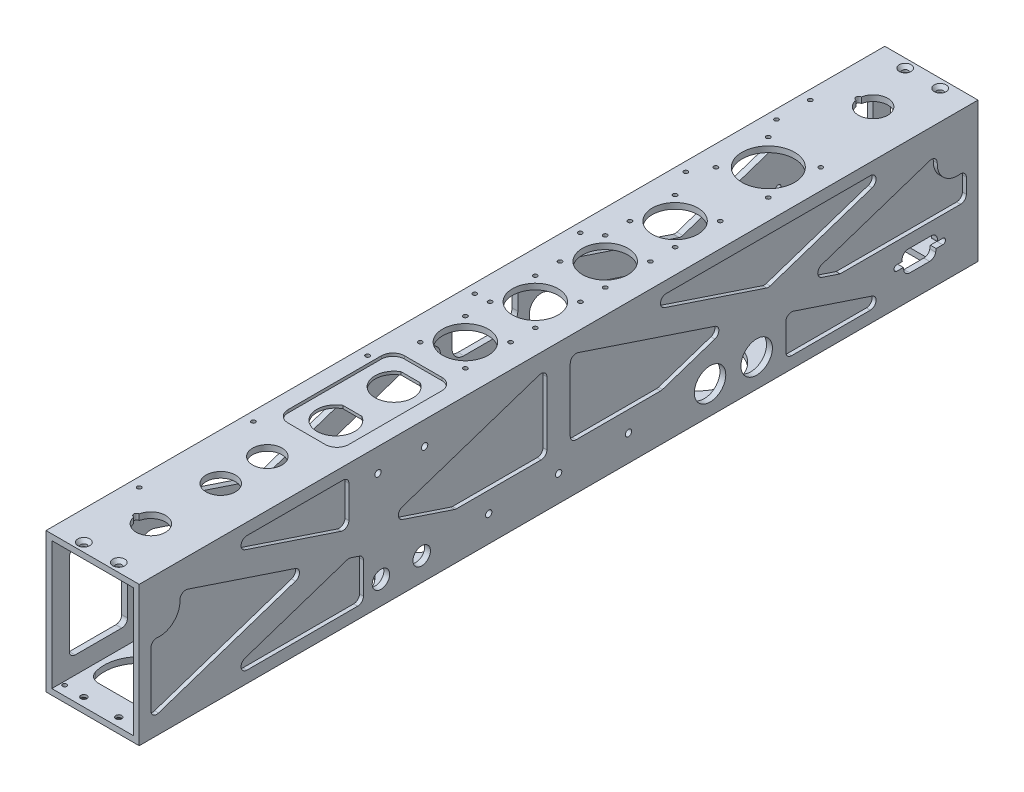
from build123d import *

# Parameters (mm, degrees)
SKETCH1_W                                     = 50.8
SKETCH1_H                                     = 76.2
SKETCH1_W_2                                   = 44.45
SKETCH1_H_2                                   = 69.85
BOSS_EXTRUDE1_DEPTH                           = 457.2
CUT_EXTRUDE2_REACH                            = 468.282
SKETCH6_W                                     = 53.975
SKETCH6_H                                     = 76.2
BOSS_EXTRUDE2_DEPTH                           = 3.175
CUT_EXTRUDE4_REACH                            = 468.282
SKETCH7_W                                     = 31.75
SKETCH7_H                                     = 50.8
FILLET1_R                                     = 3.175
CUT_EXTRUDE6_REACH                            = 468.282
CUT_EXTRUDE5_REACH                            = 468.282
SKETCH8_R                                     = 8.001
SKETCH8_R_2                                   = 14.2875
F_4_40_TAPPED_HOLE1_D                         = 2.2606
F_4_40_TAPPED_HOLE1_DEPTH                     = 3.175
SKETCH12_R                                    = 11.1125
BOSS_EXTRUDE3_DEPTH                           = 3.175
BOSS_EXTRUDE7_DEPTH                           = 3.175
FILLET6_R                                     = 3.175
CUT_EXTRUDE9_REACH                            = 468.282
SKETCH18_R                                    = 1.524
CUT_EXTRUDE10_REACH                           = 468.282
SKETCH19_R                                    = 12.4333
F_4_40_TAPPED_HOLE2_REACH                     = 468.282
F_4_40_TAPPED_HOLE2_BORE_R                    = 1.1303
LPATTERN1_COUNT                               = 4
LPATTERN1_PITCH                               = 38.1
CUT_EXTRUDE11_REACH                           = 468.282
F_6_32_TAPPED_HOLE1_D                         = 2.7051
F_6_32_TAPPED_HOLE1_DEPTH                     = 3.175
LPATTERN2_COUNT                               = 2
LPATTERN2_PITCH                               = 177.8
CUT_EXTRUDE14_REACH                           = 467.947
CUT_EXTRUDE15_REACH                           = 468.282
CUT_EXTRUDE16_REACH                           = 468.282
CUT_EXTRUDE17_REACH                           = 468.282
SKETCH31_R                                    = 19.05
BOSS_EXTRUDE6_DEPTH                           = 3.175
FILLET7_R                                     = 3.175
FILLET8_R                                     = 3.175
F_8_32_TAPPED_HOLE1_D                         = 3.4544
SKETCH40_W                                    = 127
SKETCH40_H                                    = 25.4
BOSS_EXTRUDE8_DEPTH                           = 3.175
FILLET9_R                                     = 3.175
F_8_32_TAPPED_HOLE2_D                         = 3.4544
F_8_32_TAPPED_HOLE2_DEPTH                     = 3.175
BOSS_EXTRUDE9_DEPTH                           = 3.175
FILLET11_R                                    = 3.175
FILLET12_R                                    = 3.175
CUT_EXTRUDE18_REACH                           = 468.282
SKETCH45_R                                    = 4.7625
BOSS_EXTRUDE10_DEPTH                          = 3.175
FILLET13_R                                    = 3.175
CUT_EXTRUDE19_REACH                           = 468.282
SKETCH47_R                                    = 8.5725
CSK_FOR_4_FLAT_HEAD_SOCKET_CAP_SCREW1_A_COUNT = 2
CSK_FOR_4_FLAT_HEAD_SOCKET_CAP_SCREW1_A_PITCH = 19.05
BOSS_EXTRUDE11_START                          = -1.016
BOSS_EXTRUDE11_DEPTH                          = 1.016
BOSS_EXTRUDE12_DEPTH                          = 3.175
FILLET14_R                                    = 6.35
F_4_40_TAPPED_HOLE3_D                         = 2.2606
F_4_40_TAPPED_HOLE3_DEPTH                     = 3.175
CUT_EXTRUDE20_DEPTH                           = 1.5875
F_4_40_TAPPED_HOLE4_D                         = 2.2606
F_4_40_TAPPED_HOLE4_DEPTH                     = 7.62
F_4_40_TAPPED_HOLE4_TIP                       = 0.679152758


with BuildPart() as part:
    # Sketch1 → Boss-Extrude1 (new body)
    with BuildSketch(Plane.XY):
        with Locations((25.4, 38.1)):
            Rectangle(SKETCH1_W, SKETCH1_H)
        with Locations((25.4, 38.1)):
            Rectangle(SKETCH1_W_2, SKETCH1_H_2, mode=Mode.SUBTRACT)
    extrude(amount=BOSS_EXTRUDE1_DEPTH)

    # Sketch2 → Cut-Extrude2 (cut, up to next)
    with BuildSketch(Plane(origin=(50.8, 0, 0), x_dir=(0, 0, -1), z_dir=(1, 0, 0)), mode=Mode.PRIVATE) as cut_extrude2_sk1:
        with BuildLine():
            Line((-222.25, 62.984768429), (-222.25, 13.215231571))
            ThreePointArc((-222.25, 13.215231571), (-220.931455154, 10.639537633), (-218.070976843, 10.2031621))
            Line((-218.070976843, 10.2031621), (-143.416671556, 35.087930529))
            ThreePointArc((-143.416671556, 35.087930529), (-141.245694713, 38.1), (-143.416671556, 41.112069471))
            Line((-143.416671556, 41.112069471), (-218.070976843, 65.9968379))
            ThreePointArc((-218.070976843, 65.9968379), (-220.931455154, 65.560462367), (-222.25, 62.984768429))
        make_face()
    cut_extrude2_tool1 = extrude(cut_extrude2_sk1.sketch, amount=-CUT_EXTRUDE2_REACH, mode=Mode.PRIVATE) & part.part
    # Sketch2 → Cut-Extrude2 (cut, up to next)
    with BuildSketch(Plane(origin=(50.8, 0, 0), x_dir=(0, 0, -1), z_dir=(1, 0, 0)), mode=Mode.PRIVATE) as cut_extrude2_sk2:
        with BuildLine():
            Line((-399.508328444, 63.662930529), (-343.904023157, 45.1281621))
            ThreePointArc((-343.904023157, 45.1281621), (-342.9, 44.965231571), (-341.895976843, 45.1281621))
            Line((-341.895976843, 45.1281621), (-286.291671556, 63.662930529))
            ThreePointArc((-286.291671556, 63.662930529), (-284.161692035, 67.183578622), (-287.295694713, 69.85))
            Line((-287.295694713, 69.85), (-398.504305287, 69.85))
            ThreePointArc((-398.504305287, 69.85), (-401.638307965, 67.183578622), (-399.508328444, 63.662930529))
        make_face()
    cut_extrude2_tool2 = extrude(cut_extrude2_sk2.sketch, amount=-CUT_EXTRUDE2_REACH, mode=Mode.PRIVATE) & part.part
    # Sketch2 → Cut-Extrude2 (cut, up to next)
    with BuildSketch(Plane(origin=(50.8, 0, 0), x_dir=(0, 0, -1), z_dir=(1, 0, 0)), mode=Mode.PRIVATE) as cut_extrude2_sk3:
        with BuildLine():
            Line((-446.670976843, 65.9968379), (-372.016671556, 41.112069471))
            ThreePointArc((-372.016671556, 41.112069471), (-369.845694713, 38.1), (-372.016671556, 35.087930529))
            Line((-372.016671556, 35.087930529), (-446.670976843, 10.2031621))
            ThreePointArc((-446.670976843, 10.2031621), (-449.531455154, 10.639537633), (-450.85, 13.215231571))
            Line((-450.85, 13.215231571), (-450.85, 62.984768429))
            ThreePointArc((-450.85, 62.984768429), (-449.531455154, 65.560462367), (-446.670976843, 65.9968379))
        make_face()
    cut_extrude2_tool3 = extrude(cut_extrude2_sk3.sketch, amount=-CUT_EXTRUDE2_REACH, mode=Mode.PRIVATE) & part.part
    # Sketch2 → Cut-Extrude2 (cut, up to next)
    with BuildSketch(Plane(origin=(50.8, 0, 0), x_dir=(0, 0, -1), z_dir=(1, 0, 0)), mode=Mode.PRIVATE) as cut_extrude2_sk4:
        with BuildLine():
            Line((-234.95, 62.984768429), (-234.95, 13.215231571))
            ThreePointArc((-234.95, 13.215231571), (-236.268544846, 10.639537633), (-239.129023157, 10.2031621))
            Line((-239.129023157, 10.2031621), (-313.783328444, 35.087930529))
            ThreePointArc((-313.783328444, 35.087930529), (-315.954305287, 38.1), (-313.783328444, 41.112069471))
            Line((-313.783328444, 41.112069471), (-239.129023157, 65.9968379))
            ThreePointArc((-239.129023157, 65.9968379), (-236.268544846, 65.560462367), (-234.95, 62.984768429))
        make_face()
    cut_extrude2_tool4 = extrude(cut_extrude2_sk4.sketch, amount=-CUT_EXTRUDE2_REACH, mode=Mode.PRIVATE) & part.part
    # Sketch2 → Cut-Extrude2 (cut, up to next)
    with BuildSketch(Plane(origin=(50.8, 0, 0), x_dir=(0, 0, -1), z_dir=(1, 0, 0)), mode=Mode.PRIVATE) as cut_extrude2_sk5:
        with BuildLine():
            Line((-57.691671556, 63.662930529), (-113.295976843, 45.1281621))
            ThreePointArc((-113.295976843, 45.1281621), (-114.3, 44.965231571), (-115.304023157, 45.1281621))
            Line((-115.304023157, 45.1281621), (-170.908328444, 63.662930529))
            ThreePointArc((-170.908328444, 63.662930529), (-173.038307965, 67.183578622), (-169.904305287, 69.85))
            Line((-169.904305287, 69.85), (-58.695694713, 69.85))
            ThreePointArc((-58.695694713, 69.85), (-55.561692035, 67.183578622), (-57.691671556, 63.662930529))
        make_face()
    cut_extrude2_tool5 = extrude(cut_extrude2_sk5.sketch, amount=-CUT_EXTRUDE2_REACH, mode=Mode.PRIVATE) & part.part
    # Sketch2 → Cut-Extrude2 (cut, up to next)
    with BuildSketch(Plane(origin=(50.8, 0, 0), x_dir=(0, 0, -1), z_dir=(1, 0, 0)), mode=Mode.PRIVATE) as cut_extrude2_sk6:
        with BuildLine():
            Line((-10.529023157, 65.9968379), (-85.183328444, 41.112069471))
            ThreePointArc((-85.183328444, 41.112069471), (-87.354305287, 38.1), (-85.183328444, 35.087930529))
            Line((-85.183328444, 35.087930529), (-10.529023157, 10.2031621))
            ThreePointArc((-10.529023157, 10.2031621), (-7.668544846, 10.639537633), (-6.35, 13.215231571))
            Line((-6.35, 13.215231571), (-6.35, 62.984768429))
            ThreePointArc((-6.35, 62.984768429), (-7.668544846, 65.560462367), (-10.529023157, 65.9968379))
        make_face()
    cut_extrude2_tool6 = extrude(cut_extrude2_sk6.sketch, amount=-CUT_EXTRUDE2_REACH, mode=Mode.PRIVATE) & part.part
    # Sketch2 → Cut-Extrude2 (cut, up to next)
    with BuildSketch(Plane(origin=(50.8, 0, 0), x_dir=(0, 0, -1), z_dir=(1, 0, 0)), mode=Mode.PRIVATE) as cut_extrude2_sk7:
        with BuildLine():
            Line((-398.504305287, 6.35), (-287.295694713, 6.35))
            ThreePointArc((-287.295694713, 6.35), (-284.161692035, 9.016421378), (-286.291671556, 12.537069471))
            Line((-286.291671556, 12.537069471), (-341.895976843, 31.0718379))
            ThreePointArc((-341.895976843, 31.0718379), (-342.9, 31.234768429), (-343.904023157, 31.0718379))
            Line((-343.904023157, 31.0718379), (-399.508328444, 12.537069471))
            ThreePointArc((-399.508328444, 12.537069471), (-401.638307965, 9.016421378), (-398.504305287, 6.35))
        make_face()
    cut_extrude2_tool7 = extrude(cut_extrude2_sk7.sketch, amount=-CUT_EXTRUDE2_REACH, mode=Mode.PRIVATE) & part.part
    # Sketch2 → Cut-Extrude2 (cut, up to next)
    with BuildSketch(Plane(origin=(50.8, 0, 0), x_dir=(0, 0, -1), z_dir=(1, 0, 0)), mode=Mode.PRIVATE) as cut_extrude2_sk8:
        with BuildLine():
            Line((-113.295976843, 31.0718379), (-57.691671556, 12.537069471))
            ThreePointArc((-57.691671556, 12.537069471), (-55.561692035, 9.016421378), (-58.695694713, 6.35))
            Line((-58.695694713, 6.35), (-169.904305287, 6.35))
            ThreePointArc((-169.904305287, 6.35), (-173.038307965, 9.016421378), (-170.908328444, 12.537069471))
            Line((-170.908328444, 12.537069471), (-115.304023157, 31.0718379))
            ThreePointArc((-115.304023157, 31.0718379), (-114.3, 31.234768429), (-113.295976843, 31.0718379))
        make_face()
    cut_extrude2_tool8 = extrude(cut_extrude2_sk8.sketch, amount=-CUT_EXTRUDE2_REACH, mode=Mode.PRIVATE) & part.part
    add(cut_extrude2_tool1.solids().sort_by_distance((50.8, 38.1, 193.233439))[0], mode=Mode.SUBTRACT)
    add(cut_extrude2_tool2.solids().sort_by_distance((50.8, 61.149745, 342.9))[0], mode=Mode.SUBTRACT)
    add(cut_extrude2_tool3.solids().sort_by_distance((50.8, 38.1, 421.833439))[0], mode=Mode.SUBTRACT)
    add(cut_extrude2_tool4.solids().sort_by_distance((50.8, 38.1, 263.966561))[0], mode=Mode.SUBTRACT)
    add(cut_extrude2_tool5.solids().sort_by_distance((50.8, 61.149745, 114.3))[0], mode=Mode.SUBTRACT)
    add(cut_extrude2_tool6.solids().sort_by_distance((50.8, 38.1, 35.366561))[0], mode=Mode.SUBTRACT)
    add(cut_extrude2_tool7.solids().sort_by_distance((50.8, 15.050255, 342.9))[0], mode=Mode.SUBTRACT)
    add(cut_extrude2_tool8.solids().sort_by_distance((50.8, 15.050255, 114.3))[0], mode=Mode.SUBTRACT)

    # Sketch6 → Boss-Extrude2 (add)
    with BuildSketch(Plane.ZY):
        with Locations((26.9875, 38.1)):
            Rectangle(SKETCH6_W, SKETCH6_H)
    boss_extrude2 = extrude(amount=-BOSS_EXTRUDE2_DEPTH)

    # Sketch7 → Cut-Extrude4 (cut, up to next)
    with BuildSketch(Plane.ZY, mode=Mode.PRIVATE) as cut_extrude4_sk1:
        with Locations((25.4, 38.1)):
            Rectangle(SKETCH7_W, SKETCH7_H)
    cut_extrude4_tool1 = extrude(cut_extrude4_sk1.sketch, amount=-CUT_EXTRUDE4_REACH, mode=Mode.PRIVATE) & part.part
    cut_extrude4 = cut_extrude4_tool1.solids().sort_by_distance((0, 38.1, 25.4))[0]
    add(cut_extrude4, mode=Mode.SUBTRACT)

    # Mirror1: Boss-Extrude2, Cut-Extrude4 across plane
    add(boss_extrude2.mirror(Plane.XY.offset(228.6)))
    add(cut_extrude4.mirror(Plane.XY.offset(228.6)), mode=Mode.SUBTRACT)

    # Fillet1
    fillet1_edges = [part.edges().sort_by_distance(p)[0] for p in [
        (1.5875, 63.5, 41.275),
        (1.5875, 12.7, 41.275),
        (1.5875, 12.7, 9.525),
        (1.5875, 63.5, 9.525),
        (1.5875, 12.7, 415.925),
        (1.5875, 63.5, 415.925),
        (1.5875, 63.5, 447.675),
        (1.5875, 12.7, 447.675),
    ]]
    fillet(fillet1_edges, radius=FILLET1_R)

    # Sketch11 → Cut-Extrude6 (cut, up to next)
    with BuildSketch(Plane(origin=(0, 76.2, 0), x_dir=(1, 0, 0), z_dir=(0, 1, 0)), mode=Mode.PRIVATE) as cut_extrude6_sk1:
        with BuildLine():
            ThreePointArc((17.541666667, -33.248865312), (33.4, -31.75), (17.541666667, -30.251134688))
            ThreePointArc((17.541666667, -30.251134688), (16.1, -31.75), (17.541666667, -33.248865312))
        make_face()
    cut_extrude6_tool1 = extrude(cut_extrude6_sk1.sketch, amount=-CUT_EXTRUDE6_REACH, mode=Mode.PRIVATE) & part.part
    cut_extrude6 = cut_extrude6_tool1.solids().sort_by_distance((25.271641, 76.2, 31.75))[0]
    add(cut_extrude6, mode=Mode.SUBTRACT)

    # Mirror3: Cut-Extrude6 across plane
    add(cut_extrude6.mirror(Plane.XY.offset(228.6)), mode=Mode.SUBTRACT)

    # Sketch8 → Cut-Extrude5 (cut, up to next)
    with BuildSketch(Plane(origin=(0, 76.2, 0), x_dir=(1, 0, 0), z_dir=(0, 1, 0)), mode=Mode.PRIVATE) as cut_extrude5_sk1:
        with Locations(Location((25.4, -387.35, 0), (0, 0, 270))):
            Circle(SKETCH8_R)
    cut_extrude5_tool1 = extrude(cut_extrude5_sk1.sketch, amount=-CUT_EXTRUDE5_REACH, mode=Mode.PRIVATE) & part.part
    # Sketch8 → Cut-Extrude5 (cut, up to next)
    with BuildSketch(Plane(origin=(0, 76.2, 0), x_dir=(1, 0, 0), z_dir=(0, 1, 0)), mode=Mode.PRIVATE) as cut_extrude5_sk2:
        with Locations(Location((25.4, -88.9, 0), (0, 0, 270))):
            Circle(SKETCH8_R_2)
    cut_extrude5_tool2 = extrude(cut_extrude5_sk2.sketch, amount=-CUT_EXTRUDE5_REACH, mode=Mode.PRIVATE) & part.part
    # Sketch8 → Cut-Extrude5 (cut, up to next)
    with BuildSketch(Plane(origin=(0, 76.2, 0), x_dir=(1, 0, 0), z_dir=(0, 1, 0)), mode=Mode.PRIVATE) as cut_extrude5_sk3:
        with Locations(Location((25.4, -361.95, 0), (0, 0, 270))):
            Circle(SKETCH8_R)
    cut_extrude5_tool3 = extrude(cut_extrude5_sk3.sketch, amount=-CUT_EXTRUDE5_REACH, mode=Mode.PRIVATE) & part.part
    add(cut_extrude5_tool1.solids().sort_by_distance((25.4, 76.2, 387.35))[0], mode=Mode.SUBTRACT)
    add(cut_extrude5_tool2.solids().sort_by_distance((25.4, 76.2, 88.9))[0], mode=Mode.SUBTRACT)
    add(cut_extrude5_tool3.solids().sort_by_distance((25.4, 76.2, 361.95))[0], mode=Mode.SUBTRACT)

    # #4-40 Tapped Hole1
    with Locations(Plane(origin=(0, 76.2, 0), x_dir=(-1, 0, 0), z_dir=(0, 1, 0))):
        with Locations((-11.1125, 74.6125), (-39.6875, 74.6125), (-39.6875, 103.1875), (-11.1125, 103.1875)):
            Hole(F_4_40_TAPPED_HOLE1_D / 2, depth=F_4_40_TAPPED_HOLE1_DEPTH)

    # Sketch12 → Boss-Extrude3 (add)
    with BuildSketch(Plane(origin=(50.8, 0, 0), x_dir=(0, 0, -1), z_dir=(1, 0, 0))):
        with Locations((-11.1125, 57.15)):
            Circle(SKETCH12_R)
        with Locations((-446.0875, 57.15)):
            Circle(SKETCH12_R)
    extrude(amount=-BOSS_EXTRUDE3_DEPTH)

    # Sketch36 → Boss-Extrude7 (add)
    with BuildSketch(Plane(origin=(50.8, 0, 0), x_dir=(0, 0, -1), z_dir=(1, 0, 0))):
        with BuildLine():
            Line((-75.169536858, 31.75), (-6.35, 31.75))
            Line((-6.35, 31.75), (-6.35, 13.215231571))
            ThreePointArc((-6.35, 13.215231571), (-7.668544846, 10.639537633), (-10.529023157, 10.2031621))
            Line((-10.529023157, 10.2031621), (-75.169536858, 31.75))
        make_face()
    extrude(amount=-BOSS_EXTRUDE7_DEPTH)

    # Fillet6
    fillet6_edges = [part.edges().sort_by_distance(p)[0] for p in [
        (49.2125, 31.75, 6.35),
    ]]
    fillet(fillet6_edges, radius=FILLET6_R)

    # Sketch18 → Cut-Extrude9 (cut, up to next)
    with BuildSketch(Plane(origin=(50.8, 0, 0), x_dir=(0, 0, -1), z_dir=(1, 0, 0)), mode=Mode.PRIVATE) as cut_extrude9_sk1:
        with BuildLine():
            Line((-38.051029637, 24.892), (-25.448970363, 24.892))
            ThreePointArc((-25.448970363, 24.892), (-22.919491612, 23.712484687), (-22.197135162, 21.016613717))
            Line((-22.197135162, 21.016613717), (-23.092876224, 15.936613717))
            ThreePointArc((-23.092876224, 15.936613717), (-24.222226738, 13.980521249), (-26.344711425, 13.208))
            Line((-26.344711425, 13.208), (-37.155288575, 13.208))
            ThreePointArc((-37.155288575, 13.208), (-39.277773262, 13.980521249), (-40.407123776, 15.936613717))
            Line((-40.407123776, 15.936613717), (-41.302864838, 21.016613717))
            ThreePointArc((-41.302864838, 21.016613717), (-40.580508388, 23.712484687), (-38.051029637, 24.892))
        make_face()
    cut_extrude9_tool1 = extrude(cut_extrude9_sk1.sketch, amount=-CUT_EXTRUDE9_REACH, mode=Mode.PRIVATE) & part.part
    # Sketch18 → Cut-Extrude9 (cut, up to next)
    with BuildSketch(Plane(origin=(50.8, 0, 0), x_dir=(0, 0, -1), z_dir=(1, 0, 0)), mode=Mode.PRIVATE) as cut_extrude9_sk2:
        with BuildLine():
            Line((-40.68737546, 17.526), (-41.224820097, 20.574))
            Line((-41.224820097, 20.574), (-44.2468, 20.574))
            ThreePointArc((-44.2468, 20.574), (-43.169169265, 20.127630735), (-42.7228, 19.05))
            ThreePointArc((-42.7228, 19.05), (-43.169169265, 17.972369265), (-44.2468, 17.526))
            Line((-44.2468, 17.526), (-40.68737546, 17.526))
        make_face()
    cut_extrude9_tool2 = extrude(cut_extrude9_sk2.sketch, amount=-CUT_EXTRUDE9_REACH, mode=Mode.PRIVATE) & part.part
    # Sketch18 → Cut-Extrude9 (cut, up to next)
    with BuildSketch(Plane(origin=(50.8, 0, 0), x_dir=(0, 0, -1), z_dir=(1, 0, 0)), mode=Mode.PRIVATE) as cut_extrude9_sk3:
        with Locations((-44.2468, 19.05)):
            Circle(SKETCH18_R)
    cut_extrude9_tool3 = extrude(cut_extrude9_sk3.sketch, amount=-CUT_EXTRUDE9_REACH, mode=Mode.PRIVATE) & part.part
    # Sketch18 → Cut-Extrude9 (cut, up to next)
    with BuildSketch(Plane(origin=(50.8, 0, 0), x_dir=(0, 0, -1), z_dir=(1, 0, 0)), mode=Mode.PRIVATE) as cut_extrude9_sk4:
        with Locations((-19.2532, 19.05)):
            Circle(SKETCH18_R)
    cut_extrude9_tool4 = extrude(cut_extrude9_sk4.sketch, amount=-CUT_EXTRUDE9_REACH, mode=Mode.PRIVATE) & part.part
    # Sketch18 → Cut-Extrude9 (cut, up to next)
    with BuildSketch(Plane(origin=(50.8, 0, 0), x_dir=(0, 0, -1), z_dir=(1, 0, 0)), mode=Mode.PRIVATE) as cut_extrude9_sk5:
        with BuildLine():
            Line((-19.2532, 20.574), (-22.275179903, 20.574))
            Line((-22.275179903, 20.574), (-22.81262454, 17.526))
            Line((-22.81262454, 17.526), (-19.2532, 17.526))
            ThreePointArc((-19.2532, 17.526), (-20.7772, 19.05), (-19.2532, 20.574))
        make_face()
    cut_extrude9_tool5 = extrude(cut_extrude9_sk5.sketch, amount=-CUT_EXTRUDE9_REACH, mode=Mode.PRIVATE) & part.part
    add(cut_extrude9_tool1.solids().sort_by_distance((50.8, 19.189179, 31.75))[0], mode=Mode.SUBTRACT)
    add(cut_extrude9_tool2.solids().sort_by_distance((50.8, 18.984801, 42.024858))[0], mode=Mode.SUBTRACT)
    add(cut_extrude9_tool3.solids().sort_by_distance((50.8, 19.05, 44.2468))[0], mode=Mode.SUBTRACT)
    add(cut_extrude9_tool4.solids().sort_by_distance((50.8, 19.05, 19.2532))[0], mode=Mode.SUBTRACT)
    add(cut_extrude9_tool5.solids().sort_by_distance((50.8, 18.984801, 21.475142))[0], mode=Mode.SUBTRACT)

    # Sketch19 → Cut-Extrude10 (cut, up to next)
    with BuildSketch(Plane(origin=(0, 76.2, 0), x_dir=(1, 0, 0), z_dir=(0, 1, 0)), mode=Mode.PRIVATE) as cut_extrude10_sk1:
        with Locations(Location((25.4, -139.7, 0), (0, 0, 270))):
            Circle(SKETCH19_R)
    cut_extrude10_tool1 = extrude(cut_extrude10_sk1.sketch, amount=-CUT_EXTRUDE10_REACH, mode=Mode.PRIVATE) & part.part
    cut_extrude10 = cut_extrude10_tool1.solids().sort_by_distance((25.4, 76.2, 139.7))[0]
    add(cut_extrude10, mode=Mode.SUBTRACT)

    # #4-40 Tapped Hole2 bore → #4-40 Tapped Hole2 (cut, up to next)
    with BuildSketch(Plane(origin=(0, 76.2, 0), x_dir=(-1, 0, 0), z_dir=(0, 1, 0)), mode=Mode.PRIVATE) as f_4_40_tapped_hole2_sk1:
        with Locations((-13.0937, 127.3937)):
            Circle(F_4_40_TAPPED_HOLE2_BORE_R)
    f_4_40_tapped_hole2_tool1 = extrude(f_4_40_tapped_hole2_sk1.sketch, amount=-F_4_40_TAPPED_HOLE2_REACH, mode=Mode.PRIVATE) & part.part
    # #4-40 Tapped Hole2 bore → #4-40 Tapped Hole2 (cut, up to next)
    with BuildSketch(Plane(origin=(0, 76.2, 0), x_dir=(-1, 0, 0), z_dir=(0, 1, 0)), mode=Mode.PRIVATE) as f_4_40_tapped_hole2_sk2:
        with Locations((-37.7063, 127.3937)):
            Circle(F_4_40_TAPPED_HOLE2_BORE_R)
    f_4_40_tapped_hole2_tool2 = extrude(f_4_40_tapped_hole2_sk2.sketch, amount=-F_4_40_TAPPED_HOLE2_REACH, mode=Mode.PRIVATE) & part.part
    # #4-40 Tapped Hole2 bore → #4-40 Tapped Hole2 (cut, up to next)
    with BuildSketch(Plane(origin=(0, 76.2, 0), x_dir=(-1, 0, 0), z_dir=(0, 1, 0)), mode=Mode.PRIVATE) as f_4_40_tapped_hole2_sk3:
        with Locations((-37.7063, 152.0063)):
            Circle(F_4_40_TAPPED_HOLE2_BORE_R)
    f_4_40_tapped_hole2_tool3 = extrude(f_4_40_tapped_hole2_sk3.sketch, amount=-F_4_40_TAPPED_HOLE2_REACH, mode=Mode.PRIVATE) & part.part
    # #4-40 Tapped Hole2 bore → #4-40 Tapped Hole2 (cut, up to next)
    with BuildSketch(Plane(origin=(0, 76.2, 0), x_dir=(-1, 0, 0), z_dir=(0, 1, 0)), mode=Mode.PRIVATE) as f_4_40_tapped_hole2_sk4:
        with Locations((-13.0937, 152.0063)):
            Circle(F_4_40_TAPPED_HOLE2_BORE_R)
    f_4_40_tapped_hole2_tool4 = extrude(f_4_40_tapped_hole2_sk4.sketch, amount=-F_4_40_TAPPED_HOLE2_REACH, mode=Mode.PRIVATE) & part.part
    f_4_40_tapped_hole2_1 = f_4_40_tapped_hole2_tool1.solids().sort_by_distance((13.0937, 76.2, 127.3937))[0]
    add(f_4_40_tapped_hole2_1, mode=Mode.SUBTRACT)
    f_4_40_tapped_hole2_2 = f_4_40_tapped_hole2_tool2.solids().sort_by_distance((37.7063, 76.2, 127.3937))[0]
    add(f_4_40_tapped_hole2_2, mode=Mode.SUBTRACT)
    f_4_40_tapped_hole2_3 = f_4_40_tapped_hole2_tool3.solids().sort_by_distance((37.7063, 76.2, 152.0063))[0]
    add(f_4_40_tapped_hole2_3, mode=Mode.SUBTRACT)
    f_4_40_tapped_hole2_4 = f_4_40_tapped_hole2_tool4.solids().sort_by_distance((13.0937, 76.2, 152.0063))[0]
    add(f_4_40_tapped_hole2_4, mode=Mode.SUBTRACT)
    f_4_40_tapped_hole2 = f_4_40_tapped_hole2_1 + f_4_40_tapped_hole2_2 + f_4_40_tapped_hole2_3 + f_4_40_tapped_hole2_4  # #4-40 Tapped Hole2 as one shape, for the pattern or mirror that repeats it

    # LPattern1: Cut-Extrude10, #4-40 Tapped Hole2 ×4
    with Locations(*[(0, 0, i * LPATTERN1_PITCH) for i in range(1, LPATTERN1_COUNT)]):
        add(cut_extrude10, mode=Mode.SUBTRACT)
        add(f_4_40_tapped_hole2, mode=Mode.SUBTRACT)

    # Sketch22 → Cut-Extrude11 (cut, up to next)
    with BuildSketch(Plane(origin=(0, 76.2, 0), x_dir=(1, 0, 0), z_dir=(0, 1, 0)), mode=Mode.PRIVATE) as cut_extrude11_sk1:
        with BuildLine():
            Line((20.193309765, -283.8577), (30.606690235, -283.8577))
            ThreePointArc((30.606690235, -283.8577), (25.4, -303.2633), (20.193309765, -283.8577))
        make_face()
    cut_extrude11_tool1 = extrude(cut_extrude11_sk1.sketch, amount=-CUT_EXTRUDE11_REACH, mode=Mode.PRIVATE) & part.part
    # Sketch22 → Cut-Extrude11 (cut, up to next)
    with BuildSketch(Plane(origin=(0, 76.2, 0), x_dir=(1, 0, 0), z_dir=(0, 1, 0)), mode=Mode.PRIVATE) as cut_extrude11_sk2:
        with BuildLine():
            Line((20.193309765, -315.6077), (30.606690235, -315.6077))
            ThreePointArc((30.606690235, -315.6077), (25.4, -335.0133), (20.193309765, -315.6077))
        make_face()
    cut_extrude11_tool2 = extrude(cut_extrude11_sk2.sketch, amount=-CUT_EXTRUDE11_REACH, mode=Mode.PRIVATE) & part.part
    add(cut_extrude11_tool1.solids().sort_by_distance((25.4, 76.2, 293.147117))[0], mode=Mode.SUBTRACT)
    add(cut_extrude11_tool2.solids().sort_by_distance((25.4, 76.2, 324.897117))[0], mode=Mode.SUBTRACT)

    # #6-32 Tapped Hole1
    with Locations(Plane.ZY):
        with Locations((61.214, 41.656), (61.214, 13.462), (203.2, 13.462), (203.2, 41.656)):
            f_6_32_tapped_hole1 = Hole(F_6_32_TAPPED_HOLE1_D / 2, depth=F_6_32_TAPPED_HOLE1_DEPTH)

    # LPattern2: #6-32 Tapped Hole1 ×2
    with Locations(*[(0, 0, i * LPATTERN2_PITCH) for i in range(1, LPATTERN2_COUNT)]):
        add(f_6_32_tapped_hole1, mode=Mode.SUBTRACT)

    # Sketch27 → Cut-Extrude14 (cut, up to next)
    with BuildSketch(Plane(origin=(3.175, 0, 0), x_dir=(0, 0, -1), z_dir=(1, 0, 0)), mode=Mode.PRIVATE) as cut_extrude14_sk1:
        with BuildLine():
            Line((-170.908328444, 63.662930529), (-115.304023157, 45.1281621))
            ThreePointArc((-115.304023157, 45.1281621), (-114.3, 44.965231571), (-113.295976843, 45.1281621))
            Line((-113.295976843, 45.1281621), (-57.691671556, 63.662930529))
            ThreePointArc((-57.691671556, 63.662930529), (-55.561692035, 67.183578622), (-58.695694713, 69.85))
            Line((-58.695694713, 69.85), (-169.904305287, 69.85))
            ThreePointArc((-169.904305287, 69.85), (-173.038307965, 67.183578622), (-170.908328444, 63.662930529))
        make_face()
    cut_extrude14_tool1 = extrude(cut_extrude14_sk1.sketch, amount=-CUT_EXTRUDE14_REACH, mode=Mode.PRIVATE) & part.part
    # Sketch27 → Cut-Extrude14 (cut, up to next)
    with BuildSketch(Plane(origin=(3.175, 0, 0), x_dir=(0, 0, -1), z_dir=(1, 0, 0)), mode=Mode.PRIVATE) as cut_extrude14_sk2:
        with BuildLine():
            Line((-203.2, 19.812), (-190.274926284, 19.812))
            ThreePointArc((-190.274926284, 19.812), (-189.257769041, 19.893994644), (-188.26687997, 20.137861057))
            Line((-188.26687997, 20.137861057), (-143.416671556, 35.087930529))
            ThreePointArc((-143.416671556, 35.087930529), (-141.245694713, 38.1), (-143.416671556, 41.112069471))
            Line((-143.416671556, 41.112069471), (-188.491953686, 56.137163515))
            ThreePointArc((-188.491953686, 56.137163515), (-194.212910308, 55.264412448), (-196.85, 50.113024572))
            Line((-196.85, 50.113024572), (-196.85, 41.656))
            ThreePointArc((-196.85, 41.656), (-198.709871939, 37.165871939), (-203.2, 35.306))
            Line((-203.2, 35.306), (-215.9, 35.306))
            ThreePointArc((-215.9, 35.306), (-220.390128061, 33.446128061), (-222.25, 28.956))
            Line((-222.25, 28.956), (-222.25, 13.215231571))
            ThreePointArc((-222.25, 13.215231571), (-220.931455154, 10.639537633), (-218.070976843, 10.2031621))
            Line((-218.070976843, 10.2031621), (-213.096729084, 11.861244686))
            ThreePointArc((-213.096729084, 11.861244686), (-210.691634147, 13.319566692), (-209.152387699, 15.673691814))
            ThreePointArc((-209.152387699, 15.673691814), (-206.824793579, 18.675767497), (-203.2, 19.812))
        make_face()
    cut_extrude14_tool2 = extrude(cut_extrude14_sk2.sketch, amount=-CUT_EXTRUDE14_REACH, mode=Mode.PRIVATE) & part.part
    # Sketch27 → Cut-Extrude14 (cut, up to next)
    with BuildSketch(Plane(origin=(3.175, 0, 0), x_dir=(0, 0, -1), z_dir=(1, 0, 0)), mode=Mode.PRIVATE) as cut_extrude14_sk3:
        with BuildLine():
            Line((-66.675, 13.243101762), (-66.675, 9.525))
            ThreePointArc((-66.675, 9.525), (-67.60493597, 7.27993597), (-69.85, 6.35))
            Line((-69.85, 6.35), (-169.904305287, 6.35))
            ThreePointArc((-169.904305287, 6.35), (-173.038307965, 9.016421378), (-170.908328444, 12.537069471))
            Line((-170.908328444, 12.537069471), (-115.304023157, 31.0718379))
            ThreePointArc((-115.304023157, 31.0718379), (-114.3, 31.234768429), (-113.295976843, 31.0718379))
            Line((-113.295976843, 31.0718379), (-68.845976843, 16.255171234))
            ThreePointArc((-68.845976843, 16.255171234), (-67.274306062, 15.099556916), (-66.675, 13.243101762))
        make_face()
    cut_extrude14_tool3 = extrude(cut_extrude14_sk3.sketch, amount=-CUT_EXTRUDE14_REACH, mode=Mode.PRIVATE) & part.part
    add(cut_extrude14_tool1.solids().sort_by_distance((3.175, 61.149745, 114.3))[0], mode=Mode.SUBTRACT)
    add(cut_extrude14_tool2.solids().sort_by_distance((3.175, 34.226648, 186.059906))[0], mode=Mode.SUBTRACT)
    add(cut_extrude14_tool3.solids().sort_by_distance((3.175, 15.285641, 116.804215))[0], mode=Mode.SUBTRACT)

    # Sketch29 → Cut-Extrude15 (cut, up to next)
    with BuildSketch(Plane.ZY, mode=Mode.PRIVATE) as cut_extrude15_sk1:
        with BuildLine():
            Line((391.691953686, 47.670496848), (401.216953686, 50.845496848))
            ThreePointArc((401.216953686, 50.845496848), (406.937910308, 49.972745781), (409.575, 44.821357905))
            Line((409.575, 44.821357905), (409.575, 31.378642095))
            ThreePointArc((409.575, 31.378642095), (406.937910308, 26.227254219), (401.216953686, 25.354503152))
            Line((401.216953686, 25.354503152), (391.691953686, 28.529503152))
            ThreePointArc((391.691953686, 28.529503152), (388.548612124, 30.840731787), (387.35, 34.553642095))
            Line((387.35, 34.553642095), (387.35, 41.646357905))
            ThreePointArc((387.35, 41.646357905), (388.548612124, 45.359268213), (391.691953686, 47.670496848))
        make_face()
    cut_extrude15_tool1 = extrude(cut_extrude15_sk1.sketch, amount=-CUT_EXTRUDE15_REACH, mode=Mode.PRIVATE) & part.part
    # Sketch29 → Cut-Extrude15 (cut, up to next)
    with BuildSketch(Plane.ZY, mode=Mode.PRIVATE) as cut_extrude15_sk2:
        with BuildLine():
            Line((343.904023157, 31.0718379), (370.308046314, 22.270496848))
            ThreePointArc((370.308046314, 22.270496848), (373.451387876, 19.959268213), (374.65, 16.246357905))
            Line((374.65, 16.246357905), (374.65, 12.7))
            ThreePointArc((374.65, 12.7), (372.790128061, 8.209871939), (368.3, 6.35))
            Line((368.3, 6.35), (287.295694713, 6.35))
            ThreePointArc((287.295694713, 6.35), (284.161692035, 9.016421378), (286.291671556, 12.537069471))
            Line((286.291671556, 12.537069471), (341.895976843, 31.0718379))
            ThreePointArc((341.895976843, 31.0718379), (342.9, 31.234768429), (343.904023157, 31.0718379))
        make_face()
    cut_extrude15_tool2 = extrude(cut_extrude15_sk2.sketch, amount=-CUT_EXTRUDE15_REACH, mode=Mode.PRIVATE) & part.part
    # Sketch29 → Cut-Extrude15 (cut, up to next)
    with BuildSketch(Plane.ZY, mode=Mode.PRIVATE) as cut_extrude15_sk3:
        with BuildLine():
            Line((253.722046314, 61.132496848), (313.783328444, 41.112069471))
            ThreePointArc((313.783328444, 41.112069471), (315.954305287, 38.1), (313.783328444, 35.087930529))
            Line((313.783328444, 35.087930529), (253.722046314, 15.067503152))
            ThreePointArc((253.722046314, 15.067503152), (248.001089692, 15.940254219), (245.364, 21.091642095))
            Line((245.364, 21.091642095), (245.364, 55.108357905))
            ThreePointArc((245.364, 55.108357905), (248.001089692, 60.259745781), (253.722046314, 61.132496848))
        make_face()
    cut_extrude15_tool3 = extrude(cut_extrude15_sk3.sketch, amount=-CUT_EXTRUDE15_REACH, mode=Mode.PRIVATE) & part.part
    # Sketch29 → Cut-Extrude15 (cut, up to next)
    with BuildSketch(Plane.ZY, mode=Mode.PRIVATE) as cut_extrude15_sk4:
        with BuildLine():
            Line((341.895976843, 45.1281621), (286.291671556, 63.662930529))
            ThreePointArc((286.291671556, 63.662930529), (284.161692035, 67.183578622), (287.295694713, 69.85))
            Line((287.295694713, 69.85), (398.504305287, 69.85))
            ThreePointArc((398.504305287, 69.85), (401.638307965, 67.183578622), (399.508328444, 63.662930529))
            Line((399.508328444, 63.662930529), (343.904023157, 45.1281621))
            ThreePointArc((343.904023157, 45.1281621), (342.9, 44.965231571), (341.895976843, 45.1281621))
        make_face()
    cut_extrude15_tool4 = extrude(cut_extrude15_sk4.sketch, amount=-CUT_EXTRUDE15_REACH, mode=Mode.PRIVATE) & part.part
    add(cut_extrude15_tool1.solids().sort_by_distance((0, 38.1, 399.216292))[0], mode=Mode.SUBTRACT)
    add(cut_extrude15_tool2.solids().sort_by_distance((0, 15.66819, 335.047471))[0], mode=Mode.SUBTRACT)
    add(cut_extrude15_tool3.solids().sort_by_distance((0, 38.1, 271.194423))[0], mode=Mode.SUBTRACT)
    add(cut_extrude15_tool4.solids().sort_by_distance((0, 61.149745, 342.9))[0], mode=Mode.SUBTRACT)

    # Sketch30 → Cut-Extrude16 (cut, up to next)
    with BuildSketch(Plane.ZY, mode=Mode.PRIVATE) as cut_extrude16_sk1:
        with BuildLine():
            Line((209.55, 69.85), (232.664, 69.85))
            ThreePointArc((232.664, 69.85), (237.154128061, 67.990128061), (239.014, 63.5))
            Line((239.014, 63.5), (239.014, 54.356))
            ThreePointArc((239.014, 54.356), (237.154128061, 49.865871939), (232.664, 48.006))
            Line((232.664, 48.006), (209.55, 48.006))
            ThreePointArc((209.55, 48.006), (205.059871939, 49.865871939), (203.2, 54.356))
            Line((203.2, 54.356), (203.2, 63.5))
            ThreePointArc((203.2, 63.5), (205.059871939, 67.990128061), (209.55, 69.85))
        make_face()
    cut_extrude16_tool1 = extrude(cut_extrude16_sk1.sketch, amount=-CUT_EXTRUDE16_REACH, mode=Mode.PRIVATE) & part.part
    add(cut_extrude16_tool1.solids().sort_by_distance((0, 58.928, 221.107))[0], mode=Mode.SUBTRACT)

    # Sketch31 → Cut-Extrude17 (cut, up to next)
    with BuildSketch(Plane.XZ, mode=Mode.PRIVATE) as cut_extrude17_sk1:
        with Locations(Location((25.4, 431.8, 0), (0, 0, 270))):
            Circle(SKETCH31_R)
    cut_extrude17_tool1 = extrude(cut_extrude17_sk1.sketch, amount=-CUT_EXTRUDE17_REACH, mode=Mode.PRIVATE) & part.part
    # Sketch31 → Cut-Extrude17 (cut, up to next)
    with BuildSketch(Plane.XZ, mode=Mode.PRIVATE) as cut_extrude17_sk2:
        with Locations(Location((25.4, 381, 0), (0, 0, 270))):
            Circle(SKETCH31_R)
    cut_extrude17_tool2 = extrude(cut_extrude17_sk2.sketch, amount=-CUT_EXTRUDE17_REACH, mode=Mode.PRIVATE) & part.part
    # Sketch31 → Cut-Extrude17 (cut, up to next)
    with BuildSketch(Plane.XZ, mode=Mode.PRIVATE) as cut_extrude17_sk3:
        with Locations(Location((25.4, 330.2, 0), (0, 0, 270))):
            Circle(SKETCH31_R)
    cut_extrude17_tool3 = extrude(cut_extrude17_sk3.sketch, amount=-CUT_EXTRUDE17_REACH, mode=Mode.PRIVATE) & part.part
    # Sketch31 → Cut-Extrude17 (cut, up to next)
    with BuildSketch(Plane.XZ, mode=Mode.PRIVATE) as cut_extrude17_sk4:
        with Locations(Location((25.4, 279.4, 0), (0, 0, 270))):
            Circle(SKETCH31_R)
    cut_extrude17_tool4 = extrude(cut_extrude17_sk4.sketch, amount=-CUT_EXTRUDE17_REACH, mode=Mode.PRIVATE) & part.part
    # Sketch31 → Cut-Extrude17 (cut, up to next)
    with BuildSketch(Plane.XZ, mode=Mode.PRIVATE) as cut_extrude17_sk5:
        with Locations(Location((25.4, 228.6, 0), (0, 0, 270))):
            Circle(SKETCH31_R)
    cut_extrude17_tool5 = extrude(cut_extrude17_sk5.sketch, amount=-CUT_EXTRUDE17_REACH, mode=Mode.PRIVATE) & part.part
    # Sketch31 → Cut-Extrude17 (cut, up to next)
    with BuildSketch(Plane.XZ, mode=Mode.PRIVATE) as cut_extrude17_sk6:
        with Locations(Location((25.4, 177.8, 0), (0, 0, 270))):
            Circle(SKETCH31_R)
    cut_extrude17_tool6 = extrude(cut_extrude17_sk6.sketch, amount=-CUT_EXTRUDE17_REACH, mode=Mode.PRIVATE) & part.part
    # Sketch31 → Cut-Extrude17 (cut, up to next)
    with BuildSketch(Plane.XZ, mode=Mode.PRIVATE) as cut_extrude17_sk7:
        with Locations(Location((25.4, 127, 0), (0, 0, 270))):
            Circle(SKETCH31_R)
    cut_extrude17_tool7 = extrude(cut_extrude17_sk7.sketch, amount=-CUT_EXTRUDE17_REACH, mode=Mode.PRIVATE) & part.part
    # Sketch31 → Cut-Extrude17 (cut, up to next)
    with BuildSketch(Plane.XZ, mode=Mode.PRIVATE) as cut_extrude17_sk8:
        with Locations(Location((25.4, 76.2, 0), (0, 0, 270))):
            Circle(SKETCH31_R)
    cut_extrude17_tool8 = extrude(cut_extrude17_sk8.sketch, amount=-CUT_EXTRUDE17_REACH, mode=Mode.PRIVATE) & part.part
    # Sketch31 → Cut-Extrude17 (cut, up to next)
    with BuildSketch(Plane.XZ, mode=Mode.PRIVATE) as cut_extrude17_sk9:
        with Locations(Location((25.4, 25.4, 0), (0, 0, 270))):
            Circle(SKETCH31_R)
    cut_extrude17_tool9 = extrude(cut_extrude17_sk9.sketch, amount=-CUT_EXTRUDE17_REACH, mode=Mode.PRIVATE) & part.part
    add(cut_extrude17_tool1.solids().sort_by_distance((25.4, 0, 431.8))[0], mode=Mode.SUBTRACT)
    add(cut_extrude17_tool2.solids().sort_by_distance((25.4, 0, 381))[0], mode=Mode.SUBTRACT)
    add(cut_extrude17_tool3.solids().sort_by_distance((25.4, 0, 330.2))[0], mode=Mode.SUBTRACT)
    add(cut_extrude17_tool4.solids().sort_by_distance((25.4, 0, 279.4))[0], mode=Mode.SUBTRACT)
    add(cut_extrude17_tool5.solids().sort_by_distance((25.4, 0, 228.6))[0], mode=Mode.SUBTRACT)
    add(cut_extrude17_tool6.solids().sort_by_distance((25.4, 0, 177.8))[0], mode=Mode.SUBTRACT)
    add(cut_extrude17_tool7.solids().sort_by_distance((25.4, 0, 127))[0], mode=Mode.SUBTRACT)
    add(cut_extrude17_tool8.solids().sort_by_distance((25.4, 0, 76.2))[0], mode=Mode.SUBTRACT)
    add(cut_extrude17_tool9.solids().sort_by_distance((25.4, 0, 25.4))[0], mode=Mode.SUBTRACT)

    # Sketch32 → Boss-Extrude6 (add)
    with BuildSketch(Plane(origin=(50.8, 0, 0), x_dir=(0, 0, -1), z_dir=(1, 0, 0))):
        with BuildLine():
            Line((-342.9, 50.8), (-342.9, 44.793487714))
            Line((-342.9, 44.793487714), (-324.880463142, 50.8))
            Line((-324.880463142, 50.8), (-285.75, 50.8))
            Line((-285.75, 50.8), (-285.75, 63.901653131))
            ThreePointArc((-285.75, 63.901653131), (-284.120694713, 66.675), (-285.75, 69.448346869))
            Line((-285.75, 69.448346869), (-285.75, 76.2))
            Line((-285.75, 76.2), (-342.9, 76.2))
            Line((-342.9, 76.2), (-342.9, 50.8))
        make_face()
    extrude(amount=-BOSS_EXTRUDE6_DEPTH)

    # Fillet7
    fillet7_edges = [part.edges().sort_by_distance(p)[0] for p in [
        (49.2125, 47.109768429, 450.85),
        (49.2125, 69.85, 342.9),
        (49.2125, 44.965231571, 342.9),
    ]]
    fillet(fillet7_edges, radius=FILLET7_R)

    # Fillet8
    fillet8_edges = [part.edges().sort_by_distance(p)[0] for p in [
        (49.2125, 47.109768429, 6.35),
        (49.2125, 62.568337535, 20.814524253),
    ]]
    fillet(fillet8_edges, radius=FILLET8_R)

    # #8-32 Tapped Hole1 (through all)
    with Locations(Plane(origin=(50.8, 0, 0), x_dir=(0, 0, -1), z_dir=(1, 0, 0))):
        with Locations((-327.025, 63.5), (-301.625, 63.5)):
            Hole(F_8_32_TAPPED_HOLE1_D / 2)

    # Sketch40 → Boss-Extrude8 (add)
    with BuildSketch(Plane(origin=(50.8, 0, 0), x_dir=(0, 0, -1), z_dir=(1, 0, 0))):
        with Locations((-228.6, 12.7)):
            Rectangle(SKETCH40_W, SKETCH40_H)
    extrude(amount=-BOSS_EXTRUDE8_DEPTH)

    # Fillet9
    fillet9_edges = [part.edges().sort_by_distance(p)[0] for p in [
        (49.2125, 62.568337535, 436.385475747),
        (49.2125, 25.4, 172.480463142),
        (49.2125, 25.4, 234.95),
        (49.2125, 25.4, 222.25),
        (49.2125, 25.4, 284.719536858),
    ]]
    fillet(fillet9_edges, radius=FILLET9_R)

    # #8-32 Tapped Hole2
    with Locations(Plane(origin=(50.8, 0, 0), x_dir=(0, 0, -1), z_dir=(1, 0, 0))):
        with Locations((-228.6, 14.2875), (-190.5, 14.2875), (-266.7, 14.2875)):
            Hole(F_8_32_TAPPED_HOLE2_D / 2, depth=F_8_32_TAPPED_HOLE2_DEPTH)

    # Sketch44 → Boss-Extrude9 (add)
    with BuildSketch(Plane(origin=(50.8, 0, 0), x_dir=(0, 0, -1), z_dir=(1, 0, 0))):
        Polygon((-290.5125, 15.875), (-296.305463142, 15.875), (-334.9625, 28.760678953), (-334.9625, 0), (-290.5125, 0), align=None)
    extrude(amount=-BOSS_EXTRUDE9_DEPTH)

    # Fillet11
    fillet11_edges = [part.edges().sort_by_distance(p)[0] for p in [
        (49.2125, 28.760678953, 334.9625),
        (49.2125, 6.35, 334.9625),
    ]]
    fillet(fillet11_edges, radius=FILLET11_R)

    # Fillet12
    fillet12_edges = [part.edges().sort_by_distance(p)[0] for p in [
        (49.2125, 6.35, 165.1),
        (49.2125, 14.473178953, 165.1),
    ]]
    fillet(fillet12_edges, radius=FILLET12_R)

    # Sketch45 → Cut-Extrude18 (cut, up to next)
    with BuildSketch(Plane(origin=(50.8, 0, 0), x_dir=(0, 0, -1), z_dir=(1, 0, 0)), mode=Mode.PRIVATE) as cut_extrude18_sk1:
        with Locations((-325.4375, 12.7)):
            Circle(SKETCH45_R)
    cut_extrude18_tool1 = extrude(cut_extrude18_sk1.sketch, amount=-CUT_EXTRUDE18_REACH, mode=Mode.PRIVATE) & part.part
    # Sketch45 → Cut-Extrude18 (cut, up to next)
    with BuildSketch(Plane(origin=(50.8, 0, 0), x_dir=(0, 0, -1), z_dir=(1, 0, 0)), mode=Mode.PRIVATE) as cut_extrude18_sk2:
        with Locations((-303.2125, 12.7)):
            Circle(SKETCH45_R)
    cut_extrude18_tool2 = extrude(cut_extrude18_sk2.sketch, amount=-CUT_EXTRUDE18_REACH, mode=Mode.PRIVATE) & part.part
    add(cut_extrude18_tool1.solids().sort_by_distance((50.8, 12.7, 325.4375))[0], mode=Mode.SUBTRACT)
    add(cut_extrude18_tool2.solids().sort_by_distance((50.8, 12.7, 303.2125))[0], mode=Mode.SUBTRACT)

    # Sketch46 → Boss-Extrude10 (add)
    with BuildSketch(Plane(origin=(50.8, 0, 0), x_dir=(0, 0, -1), z_dir=(1, 0, 0))):
        with BuildLine():
            Line((-104.775, 34.581512286), (-104.775, 6.35))
            Line((-104.775, 6.35), (-161.925, 6.35))
            ThreePointArc((-161.925, 6.35), (-164.17006403, 7.27993597), (-165.1, 9.525))
            Line((-165.1, 9.525), (-165.1, 12.184768429))
            ThreePointArc((-165.1, 12.184768429), (-164.500693938, 14.041223583), (-162.929023157, 15.1968379))
            Line((-162.929023157, 15.1968379), (-104.775, 34.581512286))
        make_face()
    extrude(amount=-BOSS_EXTRUDE10_DEPTH)

    # Fillet13
    fillet13_edges = [part.edges().sort_by_distance(p)[0] for p in [
        (49.2125, 28.231512286, 104.775),
        (49.2125, 6.35, 104.775),
    ]]
    fillet(fillet13_edges, radius=FILLET13_R)

    # Sketch47 → Cut-Extrude19 (cut, up to next)
    with BuildSketch(Plane(origin=(50.8, 0, 0), x_dir=(0, 0, -1), z_dir=(1, 0, 0)), mode=Mode.PRIVATE) as cut_extrude19_sk1:
        with Locations((-146.05, 15.24)):
            Circle(SKETCH47_R)
    cut_extrude19_tool1 = extrude(cut_extrude19_sk1.sketch, amount=-CUT_EXTRUDE19_REACH, mode=Mode.PRIVATE) & part.part
    # Sketch47 → Cut-Extrude19 (cut, up to next)
    with BuildSketch(Plane(origin=(50.8, 0, 0), x_dir=(0, 0, -1), z_dir=(1, 0, 0)), mode=Mode.PRIVATE) as cut_extrude19_sk2:
        with Locations((-120.65, 15.24)):
            Circle(SKETCH47_R)
    cut_extrude19_tool2 = extrude(cut_extrude19_sk2.sketch, amount=-CUT_EXTRUDE19_REACH, mode=Mode.PRIVATE) & part.part
    add(cut_extrude19_tool1.solids().sort_by_distance((50.8, 15.24, 146.05))[0], mode=Mode.SUBTRACT)
    add(cut_extrude19_tool2.solids().sort_by_distance((50.8, 15.24, 120.65))[0], mode=Mode.SUBTRACT)

    # Sketch49 → CSK for #4 Flat Head Socket Cap Screw1 (revolve, cut)
    with BuildSketch(Plane(origin=(15.875, 76.2, 452.4375), x_dir=(0, 0, 1), z_dir=(1, 0, 0))):
        Polygon((0, 0), (0, 3.176), (1.63195, 3.176), (1.63195, 1.848124365), (3.2385, 0), align=None)
    csk_for_4_flat_head_socket_cap_screw1 = revolve(axis=Axis((15.875, 82.55, 452.4375), (0, -1, 0)), mode=Mode.SUBTRACT)

    # CSK for #4 Flat Head Socket Cap Screw1 a: CSK for #4 Flat Head Socket Cap Screw1 ×2
    with Locations(*[(i * CSK_FOR_4_FLAT_HEAD_SOCKET_CAP_SCREW1_A_PITCH, 0, 0) for i in range(1, CSK_FOR_4_FLAT_HEAD_SOCKET_CAP_SCREW1_A_COUNT)]):
        add(csk_for_4_flat_head_socket_cap_screw1, mode=Mode.SUBTRACT)

    # Mirror4: CSK for #4 Flat Head Socket Cap Screw1 across plane
    add(csk_for_4_flat_head_socket_cap_screw1.mirror(Plane(origin=(0, 38.1, 0), x_dir=(0, 0, 1), z_dir=(0, -1, 0))), mode=Mode.SUBTRACT)

    # Mirror4 copy 1 sketch → Mirror4 copy 1 (revolve, cut)
    with BuildSketch(Plane(origin=(34.925, 0, 452.4375), x_dir=(0, 0, 1), z_dir=(1, 0, 0))):
        Polygon((0, 0), (0, -3.176), (1.63195, -3.176), (1.63195, -1.848124365), (3.2385, 0), align=None)
    revolve(axis=Axis((34.925, -6.35, 452.4375), (0, -1, 0)), mode=Mode.SUBTRACT)

    # Mirror5: CSK for #4 Flat Head Socket Cap Screw1 across plane
    add(csk_for_4_flat_head_socket_cap_screw1.mirror(Plane.XY.offset(228.6)), mode=Mode.SUBTRACT)

    # Mirror5 copy 1 sketch → Mirror5 copy 1 (revolve, cut)
    with BuildSketch(Plane(origin=(34.925, 76.2, 4.7625), x_dir=(0, 0, -1), z_dir=(1, 0, 0))):
        Polygon((0, 0), (0, -3.176), (1.63195, -3.176), (1.63195, -1.848124365), (3.2385, 0), align=None)
    revolve(axis=Axis((34.925, 82.55, 4.7625), (0, 1, 0)), mode=Mode.SUBTRACT)

    # Mirror5 copy 2 sketch → Mirror5 copy 2 (revolve, cut)
    with BuildSketch(Plane(origin=(15.875, 0, 4.7625), x_dir=(0, 0, -1), z_dir=(1, 0, 0))):
        Polygon((0, 0), (0, 3.176), (1.63195, 3.176), (1.63195, 1.848124365), (3.2385, 0), align=None)
    revolve(axis=Axis((15.875, -6.35, 4.7625), (0, 1, 0)), mode=Mode.SUBTRACT)

    # Mirror5 copy 3 sketch → Mirror5 copy 3 (revolve, cut)
    with BuildSketch(Plane(origin=(34.925, 0, 4.7625), x_dir=(0, 0, -1), z_dir=(1, 0, 0))):
        Polygon((0, 0), (0, 3.176), (1.63195, 3.176), (1.63195, 1.848124365), (3.2385, 0), align=None)
    revolve(axis=Axis((34.925, -6.35, 4.7625), (0, 1, 0)), mode=Mode.SUBTRACT)

    # Sketch51 → Boss-Extrude11 (add)
    with BuildSketch(Plane.ZY.offset(-47.625).offset(BOSS_EXTRUDE11_START)):
        with BuildLine():
            Line((9.525, 31.75), (75.169536858, 31.75))
            Line((75.169536858, 31.75), (85.183328444, 35.087930529))
            ThreePointArc((85.183328444, 35.087930529), (87.354305287, 38.1), (85.183328444, 41.112069471))
            Line((85.183328444, 41.112069471), (26.393564086, 60.708657591))
            ThreePointArc((26.393564086, 60.708657591), (23.484148167, 60.236293501), (22.216865167, 57.575124093))
            ThreePointArc((22.216865167, 57.575124093), (18.677940802, 49.010481481), (9.877777778, 46.106308711))
            ThreePointArc((9.877777778, 46.106308711), (7.408333333, 45.317473619), (6.35, 42.950968343))
            Line((6.35, 42.950968343), (6.35, 34.925))
            ThreePointArc((6.35, 34.925), (7.27993597, 32.67993597), (9.525, 31.75))
        make_face()
        with BuildLine():
            Line((57.691671556, 63.662930529), (113.295976843, 45.1281621))
            ThreePointArc((113.295976843, 45.1281621), (114.3, 44.965231571), (115.304023157, 45.1281621))
            Line((115.304023157, 45.1281621), (170.908328444, 63.662930529))
            ThreePointArc((170.908328444, 63.662930529), (173.038307965, 67.183578622), (169.904305287, 69.85))
            Line((169.904305287, 69.85), (58.695694713, 69.85))
            ThreePointArc((58.695694713, 69.85), (55.561692035, 67.183578622), (57.691671556, 63.662930529))
        make_face()
        with BuildLine():
            Line((222.25, 28.575), (222.25, 62.984768429))
            ThreePointArc((222.25, 62.984768429), (220.931455154, 65.560462367), (218.070976843, 65.9968379))
            Line((218.070976843, 65.9968379), (143.416671556, 41.112069471))
            ThreePointArc((143.416671556, 41.112069471), (141.245694713, 38.1), (143.416671556, 35.087930529))
            Line((143.416671556, 35.087930529), (171.991671556, 25.562930529))
            ThreePointArc((171.991671556, 25.562930529), (172.487116092, 25.440997322), (172.995694713, 25.4))
            Line((172.995694713, 25.4), (219.075, 25.4))
            ThreePointArc((219.075, 25.4), (221.32006403, 26.32993597), (222.25, 28.575))
        make_face()
        with BuildLine():
            Line((100.595976843, 26.838504567), (57.691671556, 12.537069471))
            ThreePointArc((57.691671556, 12.537069471), (55.561692035, 9.016421378), (58.695694713, 6.35))
            Line((58.695694713, 6.35), (101.6, 6.35))
            ThreePointArc((101.6, 6.35), (103.84506403, 7.27993597), (104.775, 9.525))
            Line((104.775, 9.525), (104.775, 23.826435096))
            ThreePointArc((104.775, 23.826435096), (103.456455154, 26.402129034), (100.595976843, 26.838504567))
        make_face()
        with BuildLine():
            Line((285.208328444, 25.562930529), (313.783328444, 35.087930529))
            ThreePointArc((313.783328444, 35.087930529), (315.954305287, 38.1), (313.783328444, 41.112069471))
            Line((313.783328444, 41.112069471), (239.129023157, 65.9968379))
            ThreePointArc((239.129023157, 65.9968379), (236.268544846, 65.560462367), (234.95, 62.984768429))
            Line((234.95, 62.984768429), (234.95, 28.575))
            ThreePointArc((234.95, 28.575), (235.87993597, 26.32993597), (238.125, 25.4))
            Line((238.125, 25.4), (284.204305287, 25.4))
            ThreePointArc((284.204305287, 25.4), (284.712883908, 25.440997322), (285.208328444, 25.562930529))
        make_face()
        with BuildLine():
            Line((347.079023157, 46.186495433), (399.508328444, 63.662930529))
            ThreePointArc((399.508328444, 63.662930529), (401.638307965, 67.183578622), (398.504305287, 69.85))
            Line((398.504305287, 69.85), (346.075, 69.85))
            ThreePointArc((346.075, 69.85), (343.82993597, 68.92006403), (342.9, 66.675))
            Line((342.9, 66.675), (342.9, 49.198564904))
            ThreePointArc((342.9, 49.198564904), (344.218544846, 46.622870966), (347.079023157, 46.186495433))
        make_face()
        with BuildLine():
            Line((430.806435914, 60.708657591), (372.016671556, 41.112069471))
            ThreePointArc((372.016671556, 41.112069471), (369.845694713, 38.1), (372.016671556, 35.087930529))
            Line((372.016671556, 35.087930529), (446.670976843, 10.2031621))
            ThreePointArc((446.670976843, 10.2031621), (449.531455154, 10.639537633), (450.85, 13.215231571))
            Line((450.85, 13.215231571), (450.85, 42.950968343))
            ThreePointArc((450.85, 42.950968343), (449.791666667, 45.317473619), (447.322222222, 46.106308711))
            ThreePointArc((447.322222222, 46.106308711), (438.522059198, 49.010481481), (434.983134833, 57.575124093))
            ThreePointArc((434.983134833, 57.575124093), (433.715851833, 60.236293501), (430.806435914, 60.708657591))
        make_face()
        with BuildLine():
            Line((338.1375, 6.35), (398.504305287, 6.35))
            ThreePointArc((398.504305287, 6.35), (401.638307965, 9.016421378), (399.508328444, 12.537069471))
            Line((399.508328444, 12.537069471), (343.904023157, 31.0718379))
            ThreePointArc((343.904023157, 31.0718379), (342.9, 31.234768429), (341.895976843, 31.0718379))
            Line((341.895976843, 31.0718379), (337.133476843, 29.4843379))
            ThreePointArc((337.133476843, 29.4843379), (335.561806062, 28.328723583), (334.9625, 26.472268429))
            Line((334.9625, 26.472268429), (334.9625, 9.525))
            ThreePointArc((334.9625, 9.525), (335.89243597, 7.27993597), (338.1375, 6.35))
        make_face()
    extrude(amount=BOSS_EXTRUDE11_DEPTH)

    # Sketch52 → Boss-Extrude12 (add)
    with BuildSketch(Plane.XZ):
        with BuildLine():
            Line((9.285506524, 441.96), (41.514493476, 441.96))
            ThreePointArc((41.514493476, 441.96), (25.4, 450.85), (9.285506524, 441.96))
        make_face()
        with BuildLine():
            Line((9.285506524, 15.24), (41.514493476, 15.24))
            ThreePointArc((41.514493476, 15.24), (25.4, 6.35), (9.285506524, 15.24))
        make_face()
    extrude(amount=-BOSS_EXTRUDE12_DEPTH)

    # Fillet14
    fillet14_edges = [part.edges().sort_by_distance(p)[0] for p in [
        (41.514493476, 1.5875, 441.96),
        (9.285506524, 1.5875, 441.96),
        (9.285506524, 1.5875, 15.24),
        (41.514493476, 1.5875, 15.24),
    ]]
    fillet(fillet14_edges, radius=FILLET14_R)

    # #4-40 Tapped Hole3
    with Locations(Plane.XZ):
        with Locations((5.08, 452.12), (45.72, 444.5), (45.72, 406.4), (45.72, 355.6), (45.72, 304.8), (45.72, 254), (45.72, 203.2), (45.72, 152.4), (45.72, 101.6), (45.72, 50.8), (45.72, 12.7), (5.08, 5.08)):
            Hole(F_4_40_TAPPED_HOLE3_D / 2, depth=F_4_40_TAPPED_HOLE3_DEPTH)

    # Sketch56 → Cut-Extrude20 (cut)
    with BuildSketch(Plane(origin=(0, 76.2, 0), x_dir=(1, 0, 0), z_dir=(0, 1, 0))):
        with BuildLine():
            Line((15.24, -276.987), (35.56, -276.987))
            ThreePointArc((35.56, -276.987), (40.050128061, -278.846871939), (41.91, -283.337))
            Line((41.91, -283.337), (41.91, -334.137))
            ThreePointArc((41.91, -334.137), (40.050128061, -338.627128061), (35.56, -340.487))
            Line((35.56, -340.487), (15.24, -340.487))
            ThreePointArc((15.24, -340.487), (10.749871939, -338.627128061), (8.89, -334.137))
            Line((8.89, -334.137), (8.89, -283.337))
            ThreePointArc((8.89, -283.337), (10.749871939, -278.846871939), (15.24, -276.987))
        make_face()
    extrude(amount=-CUT_EXTRUDE20_DEPTH, mode=Mode.SUBTRACT)

    # #4-40 Tapped Hole4
    with Locations(Plane(origin=(0, 76.2, 0), x_dir=(-1, 0, 0), z_dir=(0, 1, 0))):
        with Locations((-5.08, 64.135), (-5.08, 113.538), (-5.08, 171.069), (-5.08, 228.6), (-5.08, 411.48), (-5.08, 287.02), (-5.08, 349.25), (-5.08, 45.72)):
            Hole(F_4_40_TAPPED_HOLE4_D / 2, depth=F_4_40_TAPPED_HOLE4_DEPTH)
            with Locations((0, 0, -(F_4_40_TAPPED_HOLE4_DEPTH + F_4_40_TAPPED_HOLE4_TIP / 2))):  # 118° drill point
                Cone(0, F_4_40_TAPPED_HOLE4_D / 2, F_4_40_TAPPED_HOLE4_TIP, mode=Mode.SUBTRACT)


solid = part.part
